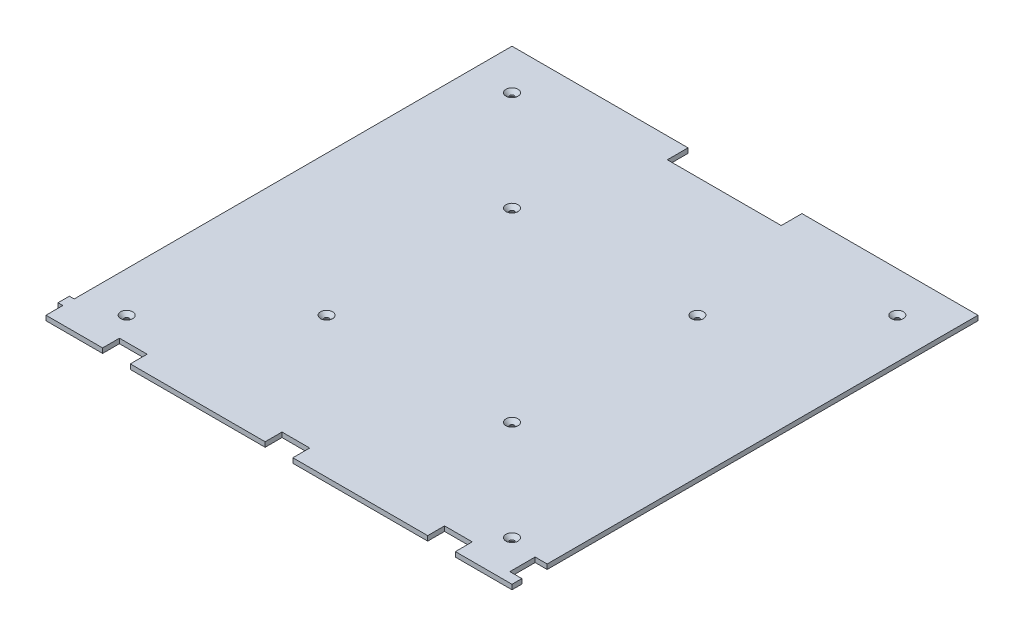
from build123d import *

# Parameters (mm, degrees)
BOSS_EXTRUDE1_DEPTH     = 2
CUT_EXTRUDE1_DEPTH      = 139.261075506
CUT_EXTRUDE1_DEPTH_BACK = 139.261075506
SKETCH2_R               = 1
CHAMFER1_SIZE           = 1.5


with BuildPart() as part:
    # Sketch1 → Boss-Extrude1 (new body)
    with BuildSketch(Plane(origin=(0, 0, 0), x_dir=(1, 0, 0), z_dir=(0, 1, 0))):
        Polygon((5.75, -96.75), (61.746519787, -96.75), (61.746519787, -89.753578842), (73.246519787, -89.753578842), (73.246519787, -96.75), (96.75, -96.75), (96.75, -92.65), (91.75, -92.65), (91.75, -82.15), (96.75, -82.15), (96.75, 96.75), (23.65, 96.75), (23.65, 88.15), (-23.65, 88.15), (-23.65, 96.75), (-96.75, 96.75), (-96.75, -85.05), (-98.75, -85.05), (-98.75, -89.75), (-96.75, -89.75), (-96.75, -96.75), (-73.246519787, -96.75), (-73.246519787, -89.753578842), (-61.746519787, -89.753578842), (-61.746519787, -96.75), (-5.75, -96.75), (-5.75, -89.753578842), (5.75, -89.753578842), align=None)
    extrude(amount=BOSS_EXTRUDE1_DEPTH)

    # Sketch2 → Cut-Extrude1 (cut, two sides: drawn at the far end of the back side and taken through both)
    with BuildSketch(Plane.XZ.offset(-CUT_EXTRUDE1_DEPTH_BACK)):
        with Locations((80, 80)):
            Circle(SKETCH2_R)
        with Locations((-80, 80)):
            Circle(SKETCH2_R)
        with Locations((-38.5, 38.5)):
            Circle(SKETCH2_R)
        with Locations((38.5, 38.5)):
            Circle(SKETCH2_R)
        with Locations((80, -80)):
            Circle(SKETCH2_R)
        with Locations((-80, -80)):
            Circle(SKETCH2_R)
        with Locations((38.5, -38.5)):
            Circle(SKETCH2_R)
        with Locations((-38.5, -38.5)):
            Circle(SKETCH2_R)
    extrude(amount=CUT_EXTRUDE1_DEPTH + CUT_EXTRUDE1_DEPTH_BACK, mode=Mode.SUBTRACT)

    # Chamfer1
    chamfer1_edges = [part.edges().sort_by_distance(p)[0] for p in [
        (79, 2, 80),
        (-81, 2, 80),
        (37.5, 2, 38.5),
        (-39.5, 2, 38.5),
        (-39.5, 2, -38.5),
        (79, 2, -80),
        (37.5, 2, -38.5),
        (-81, 2, -80),
    ]]
    chamfer(chamfer1_edges, length=CHAMFER1_SIZE)


solid = part.part
